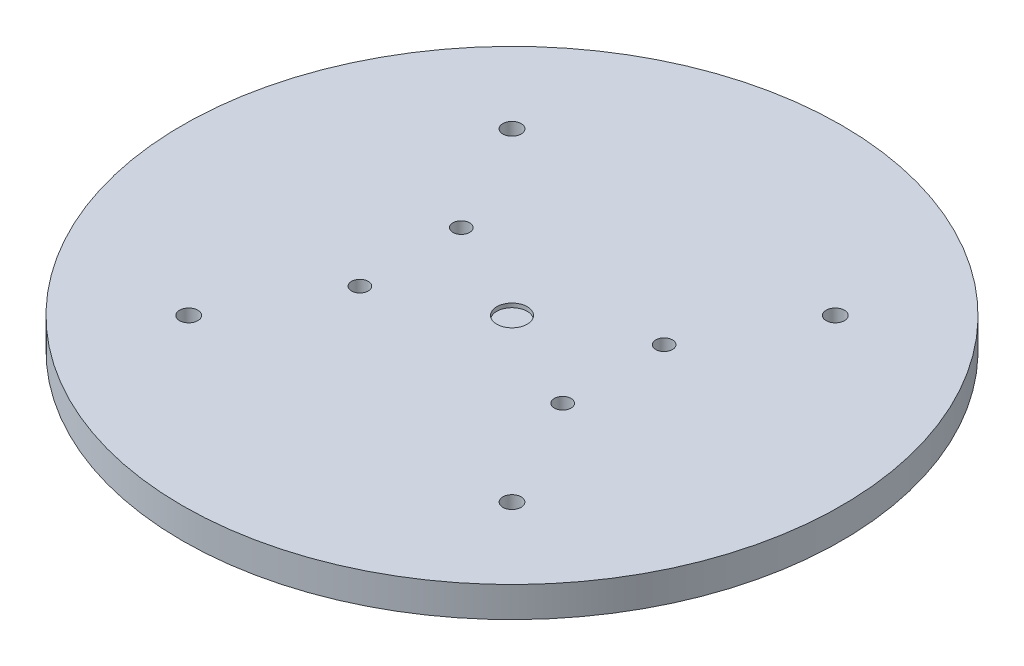
from build123d import *

# Parameters (mm, degrees)
SKETCH1_R           = 82.55
SKETCH1_R_2         = 2.286
BOSS_EXTRUDE2_DEPTH = 7.62
SKETCH2_R           = 3.81
CUT_EXTRUDE1_DEPTH  = 1.016
SKETCH3_R           = 2.1
CUT_EXTRUDE2_DEPTH  = 54.356


with BuildPart() as part:
    # Sketch1 → Boss-Extrude2 (new body)
    with BuildSketch(Plane(origin=(0, 0, 0), x_dir=(1, 0, 0), z_dir=(0, 1, 0))):
        Circle(SKETCH1_R)
        with Locations((40.49, 40.49)):
            Circle(SKETCH1_R_2, mode=Mode.SUBTRACT)
        with Locations((40.49, -40.49)):
            Circle(SKETCH1_R_2, mode=Mode.SUBTRACT)
        with Locations((-40.49, -40.49)):
            Circle(SKETCH1_R_2, mode=Mode.SUBTRACT)
        with Locations((-40.49, 40.49)):
            Circle(SKETCH1_R_2, mode=Mode.SUBTRACT)
    extrude(amount=BOSS_EXTRUDE2_DEPTH)

    # Sketch2 → Cut-Extrude1 (cut)
    with BuildSketch(Plane(origin=(0, 7.62, 0), x_dir=(1, 0, 0), z_dir=(0, 1, 0))):
        Circle(SKETCH2_R)
    extrude(amount=-CUT_EXTRUDE1_DEPTH, mode=Mode.SUBTRACT)

    # Sketch3 → Cut-Extrude2 (cut)
    with BuildSketch(Plane.XZ):
        with Locations((-25.4, 12.7)):
            Circle(SKETCH3_R)
        with Locations((25.4, 12.7)):
            Circle(SKETCH3_R)
        with Locations((25.4, -12.7)):
            Circle(SKETCH3_R)
        with Locations((-25.4, -12.7)):
            Circle(SKETCH3_R)
    extrude(amount=-CUT_EXTRUDE2_DEPTH, mode=Mode.SUBTRACT)


solid = part.part
